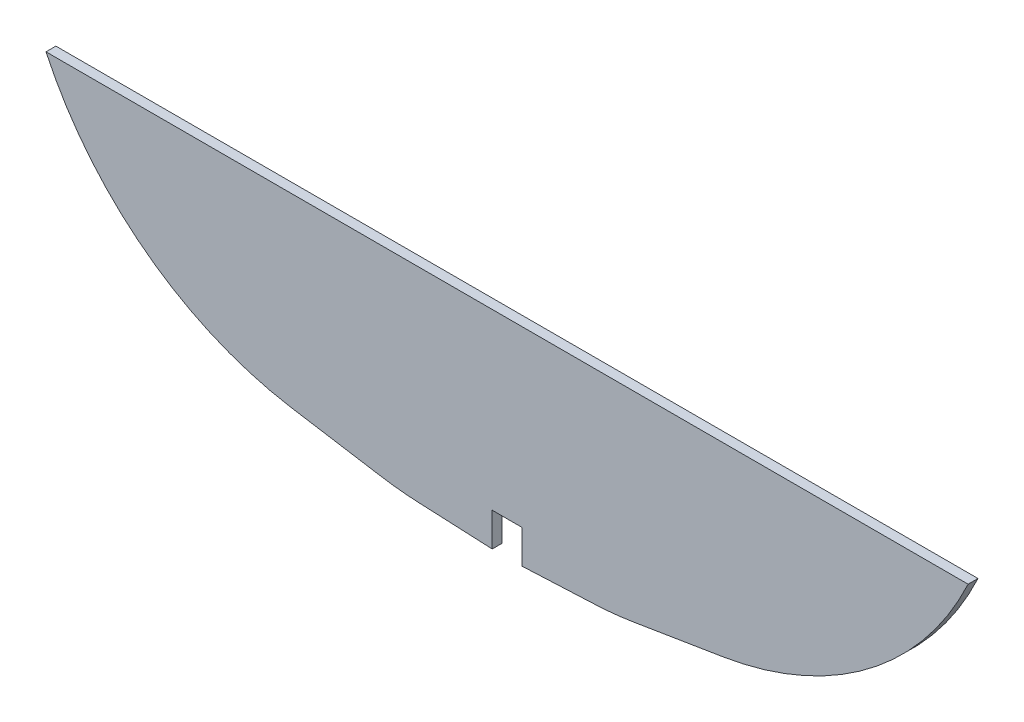
from build123d import *

# Parameters (mm, degrees)
BOSS_EXTRU_1_DEPTH = 3
CONG_1_R           = 100


with BuildPart() as part:
    # Esquisse1 → Boss.-Extru.1 (new body)
    with BuildSketch(Plane.XY):
        Polygon((-103.923413348, 35.431604979), (176.076586652, 35.431604979), (166.152848879, -10.376473534), (68.721994761, -26.257415358), (40.576586652, -27.568395021), (40.576586652, -17.368395021), (31.576586652, -17.368395021), (31.576586652, -27.568395021), (3.431178543, -26.257415358), (-93.999675575, -10.376473534), align=None)
    extrude(amount=BOSS_EXTRU_1_DEPTH)

    # Congé1
    # the kernel refuses this fillet: 100 mm, written as the material it takes off along each edge
    with BuildSketch(Plane(origin=(166.152848879, -10.376473534, -163.559702543), x_dir=(0.21172591921769693, 0.9773290823112863, 0), z_dir=(0, 0, 1))) as cong_1_piece_1:
        with BuildLine():
            CenterArc((69.095913034, 97.498917991), CONG_1_R, 201.481144987, 55.677497197)
            Line((-23.957899624, 60.879415675), (-25.818975877, 60.147025629))
            Line((-25.818975877, 60.147025629), (-1.861076253, -0.732390046))
            Line((-1.861076253, -0.732390046), (0, -2))
            ThreePointArc((0, -2), (23.435339919, -2), (46.426175173, -1.94997836))
            Line((46.426175173, -1.94997836), (46.870679837, 0))
        make_face()
    extrude(amount=330.119405086, mode=Mode.SUBTRACT)
    with BuildSketch(Plane(origin=(68.721994761, -26.257415358, -14.394746153), x_dir=(0.9869749511957248, 0.16087400570694135, 0), z_dir=(0, 0, 1)), Plane(origin=(3.431178543, -26.257415358, -14.394746153), x_dir=(0.9989169691295284, -0.04652836538152723, 0), z_dir=(0, 0, 1))) as cong_1_piece_2:
        with BuildLine():
            CenterArc((CONG_1_R * 0.057578984614, CONG_1_R), CONG_1_R, 263.409211525, 6.590788475)
            Line((-CONG_1_R * 0.0571984584269, CONG_1_R * 0.00660876862688), (-CONG_1_R * 0.0594940072877, -CONG_1_R * 0.0132590560006))
            Line((-CONG_1_R * 0.0594940072877, -CONG_1_R * 0.0132590560006), (-CONG_1_R * 0.00115157969228, -CONG_1_R * 0.02))
            Line((-CONG_1_R * 0.00115157969228, -CONG_1_R * 0.02), (CONG_1_R * 0.057578984614, -CONG_1_R * 0.02))
            Line((CONG_1_R * 0.057578984614, -CONG_1_R * 0.02), (CONG_1_R * 0.057578984614, 0))
        make_face()
    extrude(amount=31.789492307, mode=Mode.SUBTRACT)
    with BuildSketch(Plane(origin=(-93.999675575, -10.376473534, -163.559702543), x_dir=(0.9869749511957245, -0.1608740057069428, 0), z_dir=(0, 0, 1))) as cong_1_piece_3:
        with BuildLine():
            CenterArc((65.423881017, 100), CONG_1_R, 214.322502803, 55.677497197)
            Line((-17.163809688, 43.614954607), (-18.815563502, 42.487253699))
            ThreePointArc((-18.815563502, 42.487253699), (-10.442981097, 21.075087257), (-1.861076253, -0.732390046))
            Line((-1.861076253, -0.732390046), (0, -2))
            Line((0, -2), (65.423881017, -2))
            Line((65.423881017, -2), (65.423881017, 0))
        make_face()
    extrude(amount=330.119405086, mode=Mode.SUBTRACT)


solid = part.part
